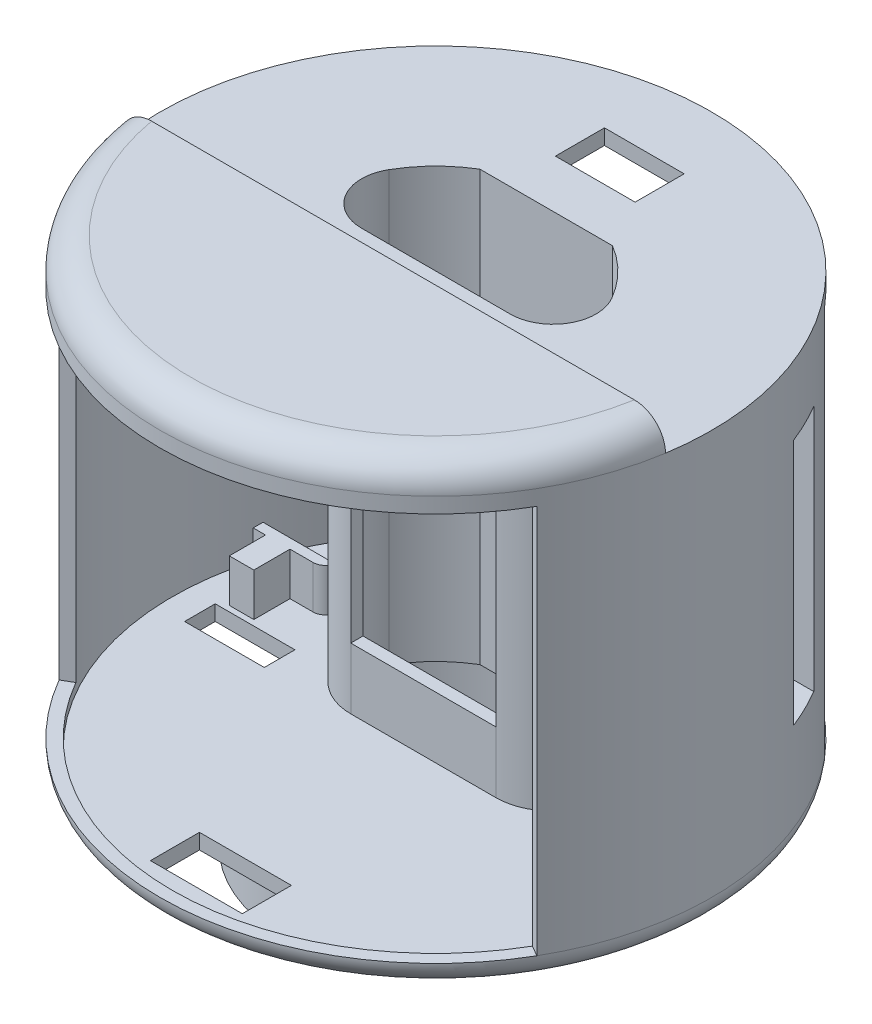
from build123d import *
from build123d.topology import SkipClean

# Parameters (mm, degrees)
CUT_EXTRUDE1_DEPTH           = 5
CUT_EXTRUDE3_DEPTH           = 70
SKETCH8_R                    = 43
CUT_EXTRUDE4_DEPTH           = 65
FILLET1_R                    = 7
SKETCH12_W                   = 6.5
SKETCH12_H                   = 63.5
CUT_REVOLVE1_ANGLE           = 60
CUT_REVOLVE1_OTHER_WAY_ANGLE = 60
SKETCH18_W                   = 13
SKETCH18_H                   = 8
CUT_EXTRUDE13_DEPTH          = 5
SKETCH20_W                   = 100
SKETCH20_H                   = 7
CUT_EXTRUDE15_DEPTH          = 5
SKETCH19_R                   = 1.5
CUT_EXTRUDE14_DEPTH          = 12
FILLET3_R                    = 4
SKETCH24_W                   = 2
SKETCH24_H                   = 3
BOSS_EXTRUDE3_DEPTH          = 2
CIRPATTERN2_COUNT            = 5
SKETCH26_W                   = 5
SKETCH26_H                   = 63.5
CUT_REVOLVE2_ANGLE           = 50
CUT_REVOLVE2_OTHER_WAY_ANGLE = 50
FILLET8_R                    = 9
SKETCH50_W                   = 13
SKETCH50_H                   = 5
CUT_EXTRUDE23_DEPTH          = 7
WRAP1_SECTION_W              = 14
WRAP1_SECTION_H              = 8
WRAP1_ANGLE                  = 29.893450181
SKETCH52_W                   = 21.079035893
SKETCH52_H                   = 8
BOSS_EXTRUDE11_DEPTH         = 7
BOSS_EXTRUDE12_DEPTH         = 2
BOSS_EXTRUDE12_DEPTH_BACK    = 1
SKETCH53_W                   = 3
SKETCH53_H                   = 7
SKETCH54_W                   = 1.6
SKETCH54_H                   = 7
BOSS_EXTRUDE13_DEPTH         = 16
SKETCH55_W                   = 4
SKETCH55_H                   = 7
BOSS_EXTRUDE14_DEPTH         = 6
SKETCH56_W                   = 3
SKETCH56_H                   = 7
CUT_EXTRUDE24_DEPTH          = 1
FILLET9_R                    = 2
SKETCH57_R                   = 1
CUT_EXTRUDE25_DEPTH          = 2
BOSS_EXTRUDE15_START         = 14.3
BOSS_EXTRUDE15_DEPTH         = 3.544129525
BOSS_EXTRUDE15_START_2       = 19.844129625
BOSS_EXTRUDE15_2_DEPTH       = 1.455870375
BOSS_EXTRUDE15_START_3       = 28.5
BOSS_EXTRUDE15_3_DEPTH       = 43.3
BOSS_EXTRUDE15_START_4       = 17.844129525
BOSS_EXTRUDE15_4_DEPTH       = 2.0000001
BOSS_EXTRUDE15_5_DEPTH       = 1.5
BOSS_EXTRUDE15_START_5       = 70.3
BOSS_EXTRUDE15_6_DEPTH       = 1.5
BOSS_EXTRUDE15_START_6       = -10.618295229
BOSS_EXTRUDE15_7_OUTLINE_R   = 1
BOSS_EXTRUDE15_7_DEPTH       = 2
SKETCH63_W                   = 6.5
SKETCH63_H                   = 40.3
CUT_EXTRUDE27_DEPTH          = 10
CUT_EXTRUDE28_DEPTH          = 44
SKETCH67_W                   = 15
SKETCH67_H                   = 8
CUT_EXTRUDE29_DEPTH          = 5
SKETCH68_W                   = 23.715050839
SKETCH68_H                   = 50
CUT_EXTRUDE30_DEPTH          = 8


with BuildPart() as part:
    # Sketch1 → Revolve1 (revolve)
    with BuildSketch(Plane.XY, mode=Mode.PRIVATE) as revolve1_sk:
        with BuildLine():
            Line((0, 86.5), (0, 11.5))
            Line((0, 11.5), (22.7, 11.5))
            Line((22.7, 11.5), (22.7, 0))
            Line((22.7, 0), (25, 0))
            Line((25, 0), (25, 11.5))
            Line((25, 11.5), (45, 11.5))
            Line((45, 11.5), (45, 81.5))
            ThreePointArc((45, 81.5), (43.535533906, 85.035533906), (40, 86.5))
            Line((40, 86.5), (0, 86.5))
        make_face()
    revolve(revolve1_sk.sketch.rotate(Axis((0, 2, 0), (0, 1, 0)), 90), axis=Axis((0, 2, 0), (0, 1, 0)))

    # Sketch5 → Cut-Extrude1 (cut)
    with BuildSketch(Plane(origin=(0, 86.5, 0), x_dir=(1, 0, 0), z_dir=(0, 1, 0))):
        with BuildLine():
            Line((-45, 0), (45, 0))
            ThreePointArc((45, 0), (0, 45), (-45, 0))
        make_face()
    extrude(amount=-CUT_EXTRUDE1_DEPTH, mode=Mode.SUBTRACT)

    # Sketch7 → Cut-Extrude3 (cut)
    with BuildSketch(Plane.XZ.offset(-11.5)):
        with BuildLine():
            Line((21, 0), (-21, 0))
            ThreePointArc((-21, 0), (-18.277714988, -10.340461055), (-10.816653826, -18))
            Line((-10.816653826, -18), (10.816653826, -18))
            ThreePointArc((10.816653826, -18), (18.277714988, -10.340461055), (21, 0))
        make_face()
    extrude(amount=-CUT_EXTRUDE3_DEPTH, mode=Mode.SUBTRACT)

    # Sketch8 → Cut-Extrude4 (cut)
    with BuildSketch(Plane(origin=(0, 79, 0), x_dir=(1, 0, 0), z_dir=(0, 1, 0))):
        with Locations(Location((0, 0, 0), (0, 0, 270))):
            Circle(SKETCH8_R)
        with BuildLine():
            Line((22.912878475, -2), (-22.981606036, -2))
            ThreePointArc((-22.981606036, -2), (-20.067855169, 10.855581536), (-10.573881727, 20))
            Line((-10.573881727, 20), (10.505154166, 20))
            ThreePointArc((10.505154166, 20), (19.999127608, 10.855581536), (22.912878475, -2))
        make_face(mode=Mode.SUBTRACT)
    extrude(amount=-CUT_EXTRUDE4_DEPTH, mode=Mode.SUBTRACT)

    # Fillet1
    fillet1_edges = [part.edges().sort_by_distance(p)[0] for p in [
        (-21, 46.5, 0),
        (21, 46.5, 0),
    ]]
    fillet(fillet1_edges, radius=FILLET1_R)

    # Sketch12 → Cut-Revolve1 (revolve, cut)
    with BuildSketch(Plane(origin=(0, 0, 0), x_dir=(0, 0, -1), z_dir=(1, 0, 0))):
        with Locations((-44.75, 47.25)):
            Rectangle(SKETCH12_W, SKETCH12_H)
    revolve(axis=Axis((0, 81.5, 0), (0, -1, 0)), revolution_arc=CUT_REVOLVE1_ANGLE, mode=Mode.SUBTRACT)

    # Sketch12 → Cut-Revolve1 other way (revolve, cut)
    with BuildSketch(Plane(origin=(0, 0, 0), x_dir=(0, 0, -1), z_dir=(1, 0, 0))):
        with Locations((-44.75, 47.25)):
            Rectangle(SKETCH12_W, SKETCH12_H)
    revolve(axis=Axis((0, 81.5, 0), (0, 1, 0)), revolution_arc=CUT_REVOLVE1_OTHER_WAY_ANGLE, mode=Mode.SUBTRACT)

    # Sketch18 → Cut-Extrude13 (cut)
    with BuildSketch(Plane(origin=(0, 81.5, 0), x_dir=(1, 0, 0), z_dir=(0, 1, 0))):
        with Locations((0, 30)):
            Rectangle(SKETCH18_W, SKETCH18_H)
    extrude(amount=-CUT_EXTRUDE13_DEPTH, mode=Mode.SUBTRACT)

    # Sketch20 → Cut-Extrude15 (cut)
    with BuildSketch(Plane(origin=(0, 86.5, 0), x_dir=(1, 0, 0), z_dir=(0, 1, 0))):
        with Locations((0, -3.5)):
            Rectangle(SKETCH20_W, SKETCH20_H)
    extrude(amount=-CUT_EXTRUDE15_DEPTH, mode=Mode.SUBTRACT)

    # Sketch19 → Cut-Extrude14 (cut)
    with BuildSketch(Plane(origin=(0, 0, 7), x_dir=(-1, 0, 0), z_dir=(0, 0, -1))):
        with Locations((0, 84)):
            Circle(SKETCH19_R)
        with Locations((-30, 84)):
            Circle(SKETCH19_R)
        with Locations((29.452221542, 84)):
            Circle(SKETCH19_R)
    extrude(amount=-CUT_EXTRUDE14_DEPTH, mode=Mode.SUBTRACT)

    # Fillet3
    fillet3_edges = [part.edges().sort_by_distance(p)[0] for p in [
        (0, 11.5, 45),
    ]]
    fillet(fillet3_edges, radius=FILLET3_R - 0.0001)  # a hair under: the kernel refuses the full size

    # Sketch24 → Boss-Extrude3 (add)
    with BuildSketch(Plane.XZ):
        with Locations((0, -22.7)):
            Rectangle(SKETCH24_W, SKETCH24_H)
    boss_extrude3 = extrude(amount=-BOSS_EXTRUDE3_DEPTH)

    # CirPattern2: Boss-Extrude3 ×5 about axis
    cirpattern2_axis = Axis((0, 0, 0), (0, 1, 0))
    for i in range(1, CIRPATTERN2_COUNT):
        add(boss_extrude3.rotate(cirpattern2_axis, i * 360 / CIRPATTERN2_COUNT))

    # Sketch26 → Cut-Revolve2 (revolve, cut)
    with BuildSketch(Plane(origin=(0, 0, 0), x_dir=(0, 0, -1), z_dir=(1, 0, 0))):
        with Locations((45.056943441, 47.25)):
            Rectangle(SKETCH26_W, SKETCH26_H)
    revolve(axis=Axis((0, 2, 0), (0, -1, 0)), revolution_arc=CUT_REVOLVE2_ANGLE, mode=Mode.SUBTRACT)

    # Sketch26 → Cut-Revolve2 other way (revolve, cut)
    with BuildSketch(Plane(origin=(0, 0, 0), x_dir=(0, 0, -1), z_dir=(1, 0, 0))):
        with Locations((45.056943441, 47.25)):
            Rectangle(SKETCH26_W, SKETCH26_H)
    revolve(axis=Axis((0, 2, 0), (0, 1, 0)), revolution_arc=CUT_REVOLVE2_OTHER_WAY_ANGLE, mode=Mode.SUBTRACT)

    # Fillet8
    fillet8_edges = [part.edges().sort_by_distance(p)[0] for p in [
        (-22.981606036, 46.5, 2),
        (22.912878475, 46.5, 2),
    ]]
    fillet(fillet8_edges, radius=FILLET8_R)

    # Sketch50 → Cut-Extrude23 (cut)
    with BuildSketch(Plane(origin=(0, 14, 0), x_dir=(1, 0, 0), z_dir=(0, 1, 0))):
        with Locations((32, 0)):
            Rectangle(SKETCH50_W, SKETCH50_H)
        with Locations((-32, 0)):
            Rectangle(SKETCH50_W, SKETCH50_H)
    extrude(amount=-CUT_EXTRUDE23_DEPTH, mode=Mode.SUBTRACT)

    # Wrap1 section (on wrap section) → Wrap1 (revolve)
    with BuildSketch(Plane(origin=(-0.03436378, 79, 0.443056559), x_dir=(0.8417807911855657, 0, -0.5398195064936087), z_dir=(0.5398195064936087, 0, 0.8417807911855657))):
        with Locations((30, -61)):
            Rectangle(WRAP1_SECTION_W, WRAP1_SECTION_H)
    wrap1 = revolve(axis=Axis((-0.03436378, 79, 0.443056559), (0, 1, 0)), revolution_arc=WRAP1_ANGLE)

    # Mirror3: Wrap1 across plane
    add(wrap1.mirror(Plane(origin=(0, 0, 0), x_dir=(0, 0, 1), z_dir=(1, 0, 0))))

    # Sketch52 → Boss-Extrude11 (add)
    with BuildSketch(Plane(origin=(0, 0, -20), x_dir=(-1, 0, 0), z_dir=(0, 0, -1))):
        with Locations((0.03436378, 18)):
            Rectangle(SKETCH52_W, SKETCH52_H)
    extrude(amount=BOSS_EXTRUDE11_DEPTH)



with BuildPart() as body_2:
    # Sketch53 → Boss-Extrude12 (new, two sides: drawn at the far end of the back side and taken through both)
    with BuildSketch(Plane(origin=(20.823161639, 0, 0), x_dir=(0, 0, -1), z_dir=(1, 0, 0)).offset(-BOSS_EXTRUDE12_DEPTH_BACK)):
        with Locations((9.818295229, 17.8)):
            Rectangle(SKETCH53_W, SKETCH53_H)
    extrude(amount=BOSS_EXTRUDE12_DEPTH + BOSS_EXTRUDE12_DEPTH_BACK)


with BuildPart() as part_1:
    add(part.part)

    add(body_2.part)  # Boss-Extrude13 merges body 2
    # Sketch54 → Boss-Extrude13 (add)
    with BuildSketch(Plane(origin=(22.823161639, 0, 0), x_dir=(0, 0, -1), z_dir=(1, 0, 0))):
        with Locations((9.818295229, 17.8)):
            Rectangle(SKETCH54_W, SKETCH54_H)
    extrude(amount=BOSS_EXTRUDE13_DEPTH)

    # Sketch55 → Boss-Extrude14 (add)
    with BuildSketch(Plane.XY.offset(-9.118295229)):
        with Locations((34.823161639, 17.8)):
            Rectangle(SKETCH55_W, SKETCH55_H)
    extrude(amount=BOSS_EXTRUDE14_DEPTH)

    # Sketch56 → Cut-Extrude24 (cut)
    with BuildSketch(Plane.XY.offset(-9.018295229)):
        with Locations((25.823161639, 17.8)):
            Rectangle(SKETCH56_W, SKETCH56_H)
    extrude(amount=-CUT_EXTRUDE24_DEPTH, mode=Mode.SUBTRACT)

    # Fillet9
    # the kernel refuses this fillet: 2 mm, written as the material it takes off along each edge
    with BuildSketch(Plane(origin=(27.323161639, 25.630127019, -9.018295229), x_dir=(0, 0, -1), z_dir=(0, -1, 0))) as fillet9_piece_1_section:
        with BuildLine():
            CenterArc((2, 1.732050808), FILLET9_R, 180, 60)
            Line((0, 1.732050808), (0, 0))
            Line((0, 0), (1, 0))
        make_face()
    fillet9_piece_1 = extrude(amount=15.660254038, mode=Mode.PRIVATE)
    fillet9_piece_1 = split(fillet9_piece_1, bisect_by=Plane(origin=(27.323161639, 14, -9.018295229), z_dir=(0, 1, 0)), keep=Keep.TOP, mode=Mode.PRIVATE)
    add(fillet9_piece_1, mode=Mode.SUBTRACT)

    # Sketch57 → Cut-Extrude25 (cut)
    with BuildSketch(Plane(origin=(0, 0, -10.618295229), x_dir=(-1, 0, 0), z_dir=(0, 0, -1))):
        with Locations(Location((-36.823161639, 18.844129625, 0), (0, 0, 90))):
            Circle(SKETCH57_R)
    extrude(amount=-CUT_EXTRUDE25_DEPTH, mode=Mode.SUBTRACT)

    # Boss-Extrude15: read off the stored shape, not the designer's step
    # Boss-Extrude15 outline → Boss-Extrude15 (add)
    with BuildSketch(Plane(origin=(0, 0, 0), x_dir=(1, 0, 0), z_dir=(0, 1, 0)).offset(BOSS_EXTRUDE15_START)):
        with BuildLine():
            Line((-32.823161639, 9.018295229), (-29.055212446, 9.018295229))
            ThreePointArc((-29.055212446, 9.018295229), (-28.055212446, 9.286244421), (-27.323161639, 10.018295229))
            Line((-27.323161639, 10.018295229), (-24.323161639, 10.018295229))
            Line((-24.323161639, 10.018295229), (-24.323161639, 9.018295229))
            Line((-24.323161639, 9.018295229), (-22.823161639, 9.018295229))
            Line((-22.823161639, 9.018295229), (-22.823161639, 8.318295229))
            Line((-22.823161639, 8.318295229), (-20.794815555, 8.318295229))
            ThreePointArc((-20.794815555, 8.318295229), (-20.436002794, 9.828095276), (-19.823161639, 11.253812113))
            Line((-19.823161639, 11.253812113), (-19.823161639, 11.318295229))
            Line((-19.823161639, 11.318295229), (-22.823161639, 11.318295229))
            Line((-22.823161639, 11.318295229), (-22.823161639, 10.618295229))
            Line((-22.823161639, 10.618295229), (-38.823161639, 10.618295229))
            Line((-38.823161639, 10.618295229), (-38.823161639, 9.018295229))
            Line((-38.823161639, 9.018295229), (-36.823161639, 9.018295229))
            Line((-36.823161639, 9.018295229), (-36.823161639, 8.618295229))
            Line((-36.823161639, 8.618295229), (-36.823161639, 3.118295229))
            Line((-36.823161639, 3.118295229), (-32.823161639, 3.118295229))
            Line((-32.823161639, 3.118295229), (-32.823161639, 9.018295229))
        make_face()
    extrude(amount=BOSS_EXTRUDE15_DEPTH)

    # Boss-Extrude15 2 outline → Boss-Extrude15 2 (add)
    with BuildSketch(Plane(origin=(0, 0, 0), x_dir=(1, 0, 0), z_dir=(0, 1, 0)).offset(BOSS_EXTRUDE15_START_2)):
        with BuildLine():
            Line((-32.823161639, 9.018295229), (-29.055212446, 9.018295229))
            ThreePointArc((-29.055212446, 9.018295229), (-28.055212446, 9.286244421), (-27.323161639, 10.018295229))
            Line((-27.323161639, 10.018295229), (-24.323161639, 10.018295229))
            Line((-24.323161639, 10.018295229), (-24.323161639, 9.018295229))
            Line((-24.323161639, 9.018295229), (-22.823161639, 9.018295229))
            Line((-22.823161639, 9.018295229), (-22.823161639, 8.318295229))
            Line((-22.823161639, 8.318295229), (-20.794815555, 8.318295229))
            ThreePointArc((-20.794815555, 8.318295229), (-20.436002794, 9.828095276), (-19.823161639, 11.253812113))
            Line((-19.823161639, 11.253812113), (-19.823161639, 11.318295229))
            Line((-19.823161639, 11.318295229), (-22.823161639, 11.318295229))
            Line((-22.823161639, 11.318295229), (-22.823161639, 10.618295229))
            Line((-22.823161639, 10.618295229), (-38.823161639, 10.618295229))
            Line((-38.823161639, 10.618295229), (-38.823161639, 9.018295229))
            Line((-38.823161639, 9.018295229), (-36.823161639, 9.018295229))
            Line((-36.823161639, 9.018295229), (-36.823161639, 8.618295229))
            Line((-36.823161639, 8.618295229), (-36.823161639, 3.118295229))
            Line((-36.823161639, 3.118295229), (-32.823161639, 3.118295229))
            Line((-32.823161639, 3.118295229), (-32.823161639, 9.018295229))
        make_face()
    extrude(amount=BOSS_EXTRUDE15_2_DEPTH)

    # Boss-Extrude15 3 outline → Boss-Extrude15 3 (add)
    with BuildSketch(Plane(origin=(0, 0, 0), x_dir=(1, 0, 0), z_dir=(0, 1, 0)).offset(BOSS_EXTRUDE15_START_3)):
        with BuildLine():
            ThreePointArc((37.794149836, 24.425442436), (38.265624448, 23.67999125), (38.722397771, 22.925442436))
            Line((38.722397771, 22.925442436), (45, 22.925442436))
            Line((45, 22.925442436), (45, 24.425442436))
            Line((45, 24.425442436), (37.794149836, 24.425442436))
        make_face()
        with BuildLine():
            Line((45, 16.425442436), (41.895164886, 16.425442436))
            ThreePointArc((41.895164886, 16.425442436), (42.180597376, 15.677920941), (42.452693296, 14.925442436))
            Line((42.452693296, 14.925442436), (45, 14.925442436))
            Line((45, 14.925442436), (45, 16.425442436))
        make_face()
        with BuildLine():
            Line((35, 24.425442436), (35, 22.925442436))
            Line((35, 22.925442436), (36.378896205, 22.925442436))
            ThreePointArc((36.378896205, 22.925442436), (35.891901131, 23.680613024), (35.389232286, 24.425442436))
            Line((35.389232286, 24.425442436), (35, 24.425442436))
        make_face()
        with BuildLine():
            Line((39.739210369, 16.425442436), (35, 16.425442436))
            Line((35, 16.425442436), (35, 14.925442436))
            Line((35, 14.925442436), (40.326556611, 14.925442436))
            ThreePointArc((40.326556611, 14.925442436), (40.039908348, 15.678193119), (39.739210369, 16.425442436))
        make_face()
    extrude(amount=BOSS_EXTRUDE15_3_DEPTH)

    # Boss-Extrude15 4 outline → Boss-Extrude15 4 (add)
    with BuildSketch(Plane(origin=(0, 0, 0), x_dir=(1, 0, 0), z_dir=(0, 1, 0)).offset(BOSS_EXTRUDE15_START_4)):
        with BuildLine():
            Line((-32.823161639, 9.018295229), (-29.055212446, 9.018295229))
            ThreePointArc((-29.055212446, 9.018295229), (-28.055212446, 9.286244421), (-27.323161639, 10.018295229))
            Line((-27.323161639, 10.018295229), (-24.323161639, 10.018295229))
            Line((-24.323161639, 10.018295229), (-24.323161639, 9.018295229))
            Line((-24.323161639, 9.018295229), (-22.823161639, 9.018295229))
            Line((-22.823161639, 9.018295229), (-22.823161639, 8.318295229))
            Line((-22.823161639, 8.318295229), (-20.794815555, 8.318295229))
            ThreePointArc((-20.794815555, 8.318295229), (-20.436002794, 9.828095276), (-19.823161639, 11.253812113))
            Line((-19.823161639, 11.253812113), (-19.823161639, 11.318295229))
            Line((-19.823161639, 11.318295229), (-22.823161639, 11.318295229))
            Line((-22.823161639, 11.318295229), (-22.823161639, 10.618295229))
            Line((-22.823161639, 10.618295229), (-38.823161639, 10.618295229))
            Line((-38.823161639, 10.618295229), (-38.823161639, 9.018295229))
            Line((-38.823161639, 9.018295229), (-36.823161639, 9.018295229))
            Line((-36.823161639, 9.018295229), (-36.823161639, 8.618295229))
            Line((-36.823161639, 8.618295229), (-36.823161639, 3.118295229))
            Line((-36.823161639, 3.118295229), (-32.823161639, 3.118295229))
            Line((-32.823161639, 3.118295229), (-32.823161639, 9.018295229))
        make_face()
    extrude(amount=BOSS_EXTRUDE15_4_DEPTH)

    # Boss-Extrude15 5 outline → Boss-Extrude15 5 (add)
    with BuildSketch(Plane(origin=(0, 0, 0), x_dir=(1, 0, 0), z_dir=(0, 1, 0)).offset(BOSS_EXTRUDE15_START_3)):
        with BuildLine():
            Line((45, 22.925442436), (38.722397771, 22.925442436))
            ThreePointArc((38.722397771, 22.925442436), (40.439588922, 19.739291979), (41.895164886, 16.425442436))
            Line((41.895164886, 16.425442436), (45, 16.425442436))
            Line((45, 16.425442436), (45, 22.925442436))
        make_face()
        with BuildLine():
            Line((36.378896205, 22.925442436), (35, 22.925442436))
            Line((35, 22.925442436), (35, 16.425442436))
            Line((35, 16.425442436), (39.739210369, 16.425442436))
            ThreePointArc((39.739210369, 16.425442436), (38.197565853, 19.747049473), (36.378896205, 22.925442436))
        make_face()
    extrude(amount=BOSS_EXTRUDE15_5_DEPTH)

    # Boss-Extrude15 6 outline → Boss-Extrude15 6 (add)
    with BuildSketch(Plane(origin=(0, 0, 0), x_dir=(1, 0, 0), z_dir=(0, 1, 0)).offset(BOSS_EXTRUDE15_START_5)):
        with BuildLine():
            Line((45, 22.925442436), (38.722397771, 22.925442436))
            ThreePointArc((38.722397771, 22.925442436), (40.439588922, 19.739291979), (41.895164886, 16.425442436))
            Line((41.895164886, 16.425442436), (45, 16.425442436))
            Line((45, 16.425442436), (45, 22.925442436))
        make_face()
        with BuildLine():
            Line((36.378896205, 22.925442436), (35, 22.925442436))
            Line((35, 22.925442436), (35, 16.425442436))
            Line((35, 16.425442436), (39.739210369, 16.425442436))
            ThreePointArc((39.739210369, 16.425442436), (38.197565853, 19.747049473), (36.378896205, 22.925442436))
        make_face()
    extrude(amount=BOSS_EXTRUDE15_6_DEPTH)

    # Boss-Extrude15 7 outline → Boss-Extrude15 7 (cut)
    with BuildSketch(Plane.XY.offset(BOSS_EXTRUDE15_START_6)):
        with Locations((-36.823161639, 18.844129625)):
            Circle(BOSS_EXTRUDE15_7_OUTLINE_R)
    extrude(amount=BOSS_EXTRUDE15_7_DEPTH, mode=Mode.SUBTRACT)

    # Sketch63 → Cut-Extrude27 (cut)
    with BuildSketch(Plane(origin=(45, 0, 0), x_dir=(0, 0, -1), z_dir=(1, 0, 0))):
        with Locations((19.675442436, 50.15)):
            Rectangle(SKETCH63_W, SKETCH63_H)
    extrude(amount=-CUT_EXTRUDE27_DEPTH, mode=Mode.SUBTRACT)

    # Sketch66 → Cut-Extrude28 (cut)
    with SkipClean():  # the faces are left unmerged after this step: merging them gives an invalid solid
        with BuildSketch(Plane(origin=(0, 71.8, 0), x_dir=(1, 0, 0), z_dir=(0, 1, 0))):
            with BuildLine():
                Line((42.452693296, 14.925442436), (45, 14.925442436))
                Line((45, 14.925442436), (45, 24.425442436))
                Line((45, 24.425442436), (37.794149836, 24.425442436))
                ThreePointArc((37.794149836, 24.425442436), (40.403606994, 19.812837804), (42.452693296, 14.925442436))
            make_face()
        extrude(amount=-CUT_EXTRUDE28_DEPTH, mode=Mode.SUBTRACT)

    # Sketch67 → Cut-Extrude29 (cut)
    with SkipClean():  # the faces are left unmerged after this step: merging them gives an invalid solid
        with BuildSketch(Plane.XZ.offset(-11.5)):
            with Locations((0, 35.077013509)):
                Rectangle(SKETCH67_W, SKETCH67_H)
        extrude(amount=-CUT_EXTRUDE29_DEPTH, mode=Mode.SUBTRACT)

    # Sketch68 → Cut-Extrude30 (cut)
    with SkipClean():  # the faces are left unmerged after this step: merging them gives an invalid solid
        with BuildSketch(Plane.XY.offset(2)):
            with Locations((-0.034363781, 49)):
                Rectangle(SKETCH68_W, SKETCH68_H)
        extrude(amount=-CUT_EXTRUDE30_DEPTH, mode=Mode.SUBTRACT)


solid = part_1.part
